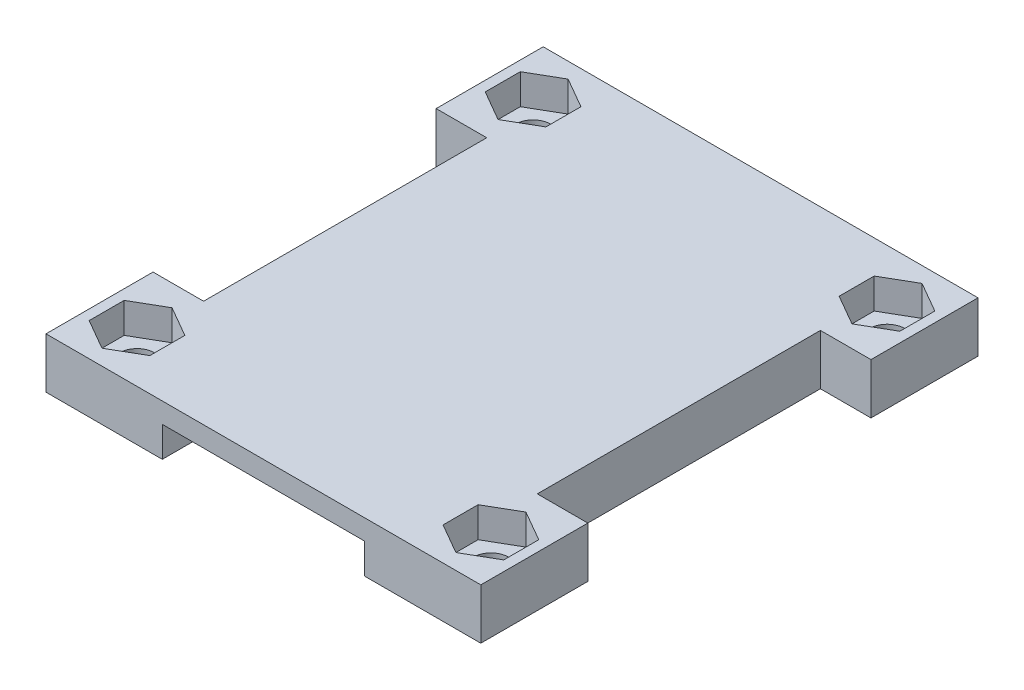
from build123d import *

# Parameters (mm, degrees)
SKETCH1_W           = 43
SKETCH1_H           = 49.17
BOSS_EXTRUDE1_DEPTH = 5
CUT_EXTRUDE1_DEPTH  = 3
SKETCH4_R           = 1.75
CUT_EXTRUDE2_DEPTH  = 66.388752091
SKETCH5_W           = 5
SKETCH5_H           = 28
CUT_EXTRUDE3_DEPTH  = 66.510983049
SKETCH7_W           = 20
SKETCH7_H           = 49.17
CUT_EXTRUDE4_DEPTH  = 3


with BuildPart() as part:
    # Sketch1 → Boss-Extrude1 (new body)
    with BuildSketch(Plane(origin=(0, 0, 0), x_dir=(1, 0, 0), z_dir=(0, 1, 0))):
        with Locations((-21.5, 24.585)):
            Rectangle(SKETCH1_W, SKETCH1_H)
    extrude(amount=BOSS_EXTRUDE1_DEPTH)

    # Sketch2 → Cut-Extrude1 (cut)
    with BuildSketch(Plane(origin=(0, 5, 0), x_dir=(1, 0, 0), z_dir=(0, 1, 0))):
        Polygon((-1, 42.437949192), (-4, 40.705898385), (-7, 42.437949192), (-7, 45.902050808), (-4, 47.634101615), (-1, 45.902050808), align=None)
        Polygon((-4, 8.464101615), (-7, 6.732050808), (-7, 3.267949192), (-4, 1.535898385), (-1, 3.267949192), (-1, 6.732050808), align=None)
        Polygon((-42, 6.732050808), (-39, 8.464101615), (-36, 6.732050808), (-36, 3.267949192), (-39, 1.535898385), (-42, 3.267949192), align=None)
        Polygon((-42, 45.902050808), (-42, 42.437949192), (-39, 40.705898385), (-36, 42.437949192), (-36, 45.902050808), (-39, 47.634101615), align=None)
    extrude(amount=-CUT_EXTRUDE1_DEPTH, mode=Mode.SUBTRACT)

    # Sketch4 → Cut-Extrude2 (cut, through all)
    with BuildSketch(Plane(origin=(0, 2, 0), x_dir=(1, 0, 0), z_dir=(0, 1, 0))):
        with Locations((-39, 44.17)):
            Circle(SKETCH4_R)
        with Locations((-39, 5)):
            Circle(SKETCH4_R)
        with Locations((-4, 5)):
            Circle(SKETCH4_R)
        with Locations((-4, 44.17)):
            Circle(SKETCH4_R)
    extrude(amount=-CUT_EXTRUDE2_DEPTH, mode=Mode.SUBTRACT)

    # Sketch5 → Cut-Extrude3 (cut, through all)
    with BuildSketch(Plane(origin=(0, 5, 0), x_dir=(1, 0, 0), z_dir=(0, 1, 0))):
        with Locations((-2.5, 24.585)):
            Rectangle(SKETCH5_W, SKETCH5_H)
        with Locations((-40.5, 24.585)):
            Rectangle(SKETCH5_W, SKETCH5_H)
    extrude(amount=-CUT_EXTRUDE3_DEPTH, mode=Mode.SUBTRACT)

    # Sketch7 → Cut-Extrude4 (cut)
    with BuildSketch(Plane.XZ):
        with Locations((-21.5, -24.585)):
            Rectangle(SKETCH7_W, SKETCH7_H)
    extrude(amount=-CUT_EXTRUDE4_DEPTH, mode=Mode.SUBTRACT)


solid = part.part
